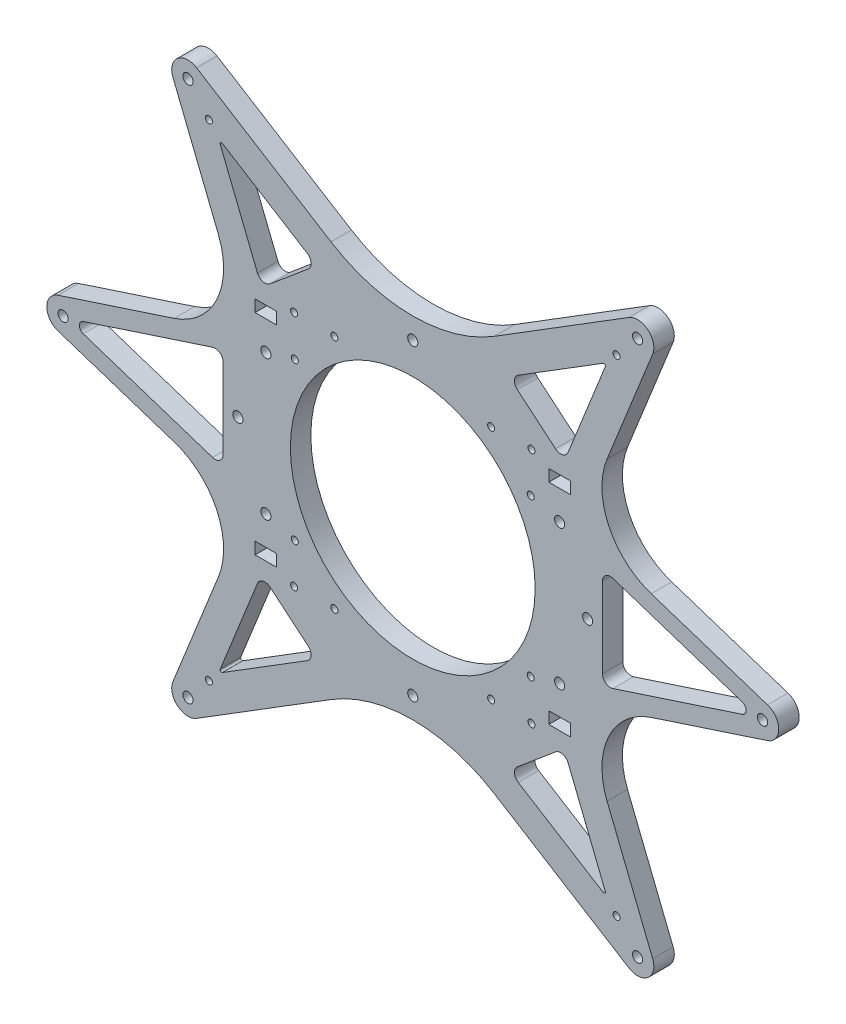
from build123d import *

# Parameters (mm, degrees)
SKETCH1_R           = 1.450000006
SKETCH1_R_2         = 1
SKETCH1_R_3         = 1.45
SKETCH1_R_4         = 35
SKETCH1_W           = 6.2
SKETCH1_H           = 3.4
BOSS_EXTRUDE1_DEPTH = 5.85


with BuildPart() as part:
    # Sketch1 → Boss-Extrude1 (new body)
    with BuildSketch(Plane.XY):
        with BuildLine():
            Line((587.995290395, 497.753361998), (601.026388312, 465.269666287))
            ThreePointArc((601.026388312, 465.269666287), (600.580353033, 449.003385667), (588.406365105, 438.205939183))
            Line((588.406365105, 438.205939183), (555.146182231, 427.30822221))
            ThreePointArc((555.146182231, 427.30822221), (551.939243509, 422.882775531), (555.146182231, 418.457328853))
            Line((555.146182231, 418.457328853), (588.406366938, 407.559611279))
            ThreePointArc((588.406366938, 407.559611279), (600.58035448, 396.762164902), (601.026389221, 380.495884628))
            Line((601.026389221, 380.495884628), (587.995289899, 348.01218948))
            ThreePointArc((587.995289899, 348.01218948), (589.32399836, 342.710908714), (594.775468563, 342.322944064))
            Line((594.775468563, 342.322944064), (633.210915705, 366.208380082))
            ThreePointArc((633.210915705, 366.208380082), (644.436635852, 371.1815144), (656.596182238, 372.882775531))
            ThreePointArc((656.596182238, 372.882775531), (668.755728624, 371.181514399), (679.981448771, 366.208380082))
            Line((679.981448771, 366.208380082), (718.416895913, 342.322944064))
            ThreePointArc((718.416895913, 342.322944064), (723.868366115, 342.710908714), (725.197074576, 348.01218948))
            Line((725.197074576, 348.01218948), (712.165975255, 380.495884628))
            ThreePointArc((712.165975255, 380.495884628), (712.612009996, 396.762164902), (724.785997538, 407.559611279))
            Line((724.785997538, 407.559611279), (758.046182244, 418.457328853))
            ThreePointArc((758.046182244, 418.457328853), (761.253120966, 422.882775531), (758.046182244, 427.30822221))
            Line((758.046182244, 427.30822221), (724.785999371, 438.205939183))
            ThreePointArc((724.785999371, 438.205939183), (712.612011443, 449.003385667), (712.165976164, 465.269666287))
            Line((712.165976164, 465.269666287), (725.197074081, 497.753361998))
            ThreePointArc((725.197074081, 497.753361998), (723.86836572, 503.054641878), (718.416896408, 503.442606583))
            Line((718.416896408, 503.442606583), (679.981448771, 479.557172561))
            ThreePointArc((679.981448771, 479.557172561), (668.755728555, 474.584038083), (656.596182238, 472.882775531))
            ThreePointArc((656.596182238, 472.882775531), (644.436635921, 474.584038083), (633.210915705, 479.557172561))
            Line((633.210915705, 479.557172561), (594.775468067, 503.442606583))
            ThreePointArc((594.775468067, 503.442606583), (589.323998755, 503.054641878), (587.995290395, 497.753361998))
        make_face()
        with Locations((592.317421269, 499.487219843)):
            Circle(SKETCH1_R, mode=Mode.SUBTRACT)
        with Locations((622.655056741, 456.823901028)):
            Circle(SKETCH1_R_2, mode=Mode.SUBTRACT)
        with Locations((614.596182238, 442.882775531)):
            Circle(SKETCH1_R_3, mode=Mode.SUBTRACT)
        with Locations((690.537307735, 456.823901028)):
            Circle(SKETCH1_R_2, mode=Mode.SUBTRACT)
        with Locations((679.012892066, 456.613193858)):
            Circle(SKETCH1_R_2, mode=Mode.SUBTRACT)
        with Locations((556.596182238, 422.882775531)):
            Circle(SKETCH1_R, mode=Mode.SUBTRACT)
        with Locations((690.326600565, 445.299485359)):
            Circle(SKETCH1_R_2, mode=Mode.SUBTRACT)
        with Locations((656.596182238, 422.882775531)):
            Circle(SKETCH1_R_4, mode=Mode.SUBTRACT)
        with Locations((656.596182238, 466.882775531)):
            Circle(SKETCH1_R_3, mode=Mode.SUBTRACT)
        with Locations((714.884162684, 492.347685633)):
            Circle(SKETCH1_R_2, mode=Mode.SUBTRACT)
        with Locations((634.17947241, 389.152357205)):
            Circle(SKETCH1_R_2, mode=Mode.SUBTRACT)
        with Locations((622.655056741, 388.941650034)):
            Circle(SKETCH1_R_2, mode=Mode.SUBTRACT)
        with Locations((592.317421269, 346.278331219)):
            Circle(SKETCH1_R, mode=Mode.SUBTRACT)
        with Locations((622.865763911, 400.466065704)):
            Circle(SKETCH1_R_2, mode=Mode.SUBTRACT)
        with Locations((656.596182238, 378.882775531)):
            Circle(SKETCH1_R_3, mode=Mode.SUBTRACT)
        with Locations((698.596182238, 442.882775531)):
            Circle(SKETCH1_R_3, mode=Mode.SUBTRACT)
        with Locations((698.596182238, 402.882775531)):
            Circle(SKETCH1_R_3, mode=Mode.SUBTRACT)
        with Locations((598.308201792, 353.417865429)):
            Circle(SKETCH1_R_2, mode=Mode.SUBTRACT)
        with Locations((622.865763911, 445.299485359)):
            Circle(SKETCH1_R_2, mode=Mode.SUBTRACT)
        with Locations((634.17947241, 456.613193858)):
            Circle(SKETCH1_R_2, mode=Mode.SUBTRACT)
        with Locations((598.308201792, 492.347685633)):
            Circle(SKETCH1_R_2, mode=Mode.SUBTRACT)
        with Locations((706.596182238, 422.882775531)):
            Circle(SKETCH1_R_3, mode=Mode.SUBTRACT)
        with Locations((679.012892066, 389.152357205)):
            Circle(SKETCH1_R_2, mode=Mode.SUBTRACT)
        with Locations((690.537307735, 388.941650034)):
            Circle(SKETCH1_R_2, mode=Mode.SUBTRACT)
        with Locations((720.874943207, 346.278331219)):
            Circle(SKETCH1_R, mode=Mode.SUBTRACT)
        with Locations((690.326600565, 400.466065704)):
            Circle(SKETCH1_R_2, mode=Mode.SUBTRACT)
        with Locations((714.884162684, 353.417865429)):
            Circle(SKETCH1_R_2, mode=Mode.SUBTRACT)
        with Locations((756.596182238, 422.882775531)):
            Circle(SKETCH1_R, mode=Mode.SUBTRACT)
        with Locations((606.596182238, 422.882775531)):
            Circle(SKETCH1_R_3, mode=Mode.SUBTRACT)
        with Locations((720.874943207, 499.487219843)):
            Circle(SKETCH1_R, mode=Mode.SUBTRACT)
        with Locations((614.596182238, 402.882775531)):
            Circle(SKETCH1_R_3, mode=Mode.SUBTRACT)
        with BuildLine():
            Line((626.454134983, 473.297704221), (602.177707148, 488.384116659))
            ThreePointArc((602.177707148, 488.384116659), (601.664667816, 488.34760519), (601.539622693, 487.848700229))
            Line((601.539622693, 487.848700229), (612.181281174, 461.321357854))
            ThreePointArc((612.181281174, 461.321357854), (613.748321683, 459.954049475), (615.775006462, 460.42062955))
            Line((615.775006462, 460.42062955), (626.717135353, 469.602165866))
            ThreePointArc((626.717135353, 469.602165866), (627.528557146, 471.51703997), (626.454134983, 473.297704221))
        make_face(mode=Mode.SUBTRACT)
        with Locations((698.596182238, 392.882775531)):
            Rectangle(SKETCH1_W, SKETCH1_H, mode=Mode.SUBTRACT)
        with BuildLine():
            Line((686.475229123, 469.602165866), (697.417358014, 460.42062955))
            ThreePointArc((697.417358014, 460.42062955), (699.444042793, 459.954049475), (701.011083302, 461.321357854))
            Line((701.011083302, 461.321357854), (711.652741783, 487.848700229))
            ThreePointArc((711.652741783, 487.848700229), (711.52769666, 488.34760519), (711.014657328, 488.384116659))
            Line((711.014657328, 488.384116659), (686.738229493, 473.297704221))
            ThreePointArc((686.738229493, 473.297704221), (685.663807329, 471.51703997), (686.475229123, 469.602165866))
        make_face(mode=Mode.SUBTRACT)
        with BuildLine():
            Line((562.360059701, 421.35524452), (599.360059701, 409.232174436))
            ThreePointArc((599.360059701, 409.232174436), (601.41475291, 409.553708225), (602.360059701, 411.406150729))
            Line((602.360059701, 411.406150729), (602.360059701, 434.359400333))
            ThreePointArc((602.360059701, 434.359400333), (601.41475291, 436.211842837), (599.360059701, 436.533376627))
            Line((599.360059701, 436.533376627), (562.360059701, 424.410306542))
            ThreePointArc((562.360059701, 424.410306542), (561.253120966, 422.882775531), (562.360059701, 421.35524452))
        make_face(mode=Mode.SUBTRACT)
        with BuildLine():
            Line((601.539622693, 357.916850834), (612.181281174, 384.444193209))
            ThreePointArc((612.181281174, 384.444193209), (613.748321683, 385.811501588), (615.775006462, 385.344921513))
            Line((615.775006462, 385.344921513), (626.717135353, 376.163385196))
            ThreePointArc((626.717135353, 376.163385196), (627.528557146, 374.248511093), (626.454134983, 372.467846842))
            Line((626.454134983, 372.467846842), (602.177707148, 357.381434403))
            ThreePointArc((602.177707148, 357.381434403), (601.664667816, 357.417945872), (601.539622693, 357.916850834))
        make_face(mode=Mode.SUBTRACT)
        with BuildLine():
            Line((686.475229123, 376.163385196), (697.417358014, 385.344921513))
            ThreePointArc((697.417358014, 385.344921513), (699.444042793, 385.811501588), (701.011083302, 384.444193209))
            Line((701.011083302, 384.444193209), (711.652741783, 357.916850834))
            ThreePointArc((711.652741783, 357.916850834), (711.52769666, 357.417945872), (711.014657328, 357.381434403))
            Line((711.014657328, 357.381434403), (686.738229493, 372.467846842))
            ThreePointArc((686.738229493, 372.467846842), (685.663807329, 374.248511093), (686.475229123, 376.163385196))
        make_face(mode=Mode.SUBTRACT)
        with Locations((614.596182238, 452.882775531)):
            Rectangle(SKETCH1_W, SKETCH1_H, mode=Mode.SUBTRACT)
        with Locations((698.596182238, 452.882775531)):
            Rectangle(SKETCH1_W, SKETCH1_H, mode=Mode.SUBTRACT)
        with BuildLine():
            Line((750.832304774, 424.410306542), (713.832304774, 436.533376627))
            ThreePointArc((713.832304774, 436.533376627), (711.777611566, 436.211842837), (710.832304774, 434.359400333))
            Line((710.832304774, 434.359400333), (710.832304774, 411.406150729))
            ThreePointArc((710.832304774, 411.406150729), (711.777611565, 409.553708225), (713.832304774, 409.232174436))
            Line((713.832304774, 409.232174436), (750.832304774, 421.35524452))
            ThreePointArc((750.832304774, 421.35524452), (751.939243509, 422.882775531), (750.832304774, 424.410306542))
        make_face(mode=Mode.SUBTRACT)
        with Locations((614.596182238, 392.882775531)):
            Rectangle(SKETCH1_W, SKETCH1_H, mode=Mode.SUBTRACT)
    extrude(amount=BOSS_EXTRUDE1_DEPTH)


solid = part.part
